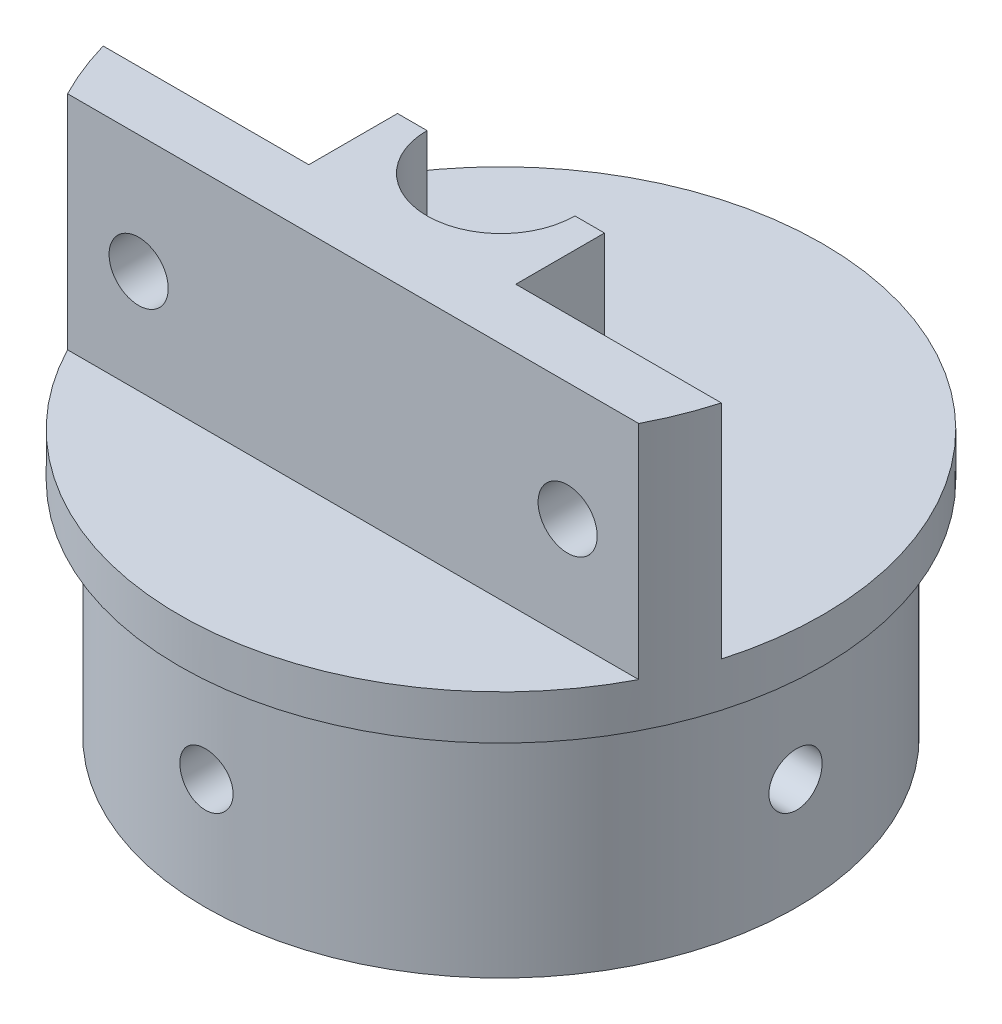
from build123d import *

# Parameters (mm, degrees)
SKETCH1_R                  = 25.4
SKETCH1_R_2                = 22.86
TUBE_CONNECTION_RING_DEPTH = 19.05
SKETCH6_R                  = 2.286
SCREW_HOLE_DEPTH           = 19.05
NUT_PRESS_FIT_HOLE_START   = -11.059647
NUT_PRESS_FIT_HOLE_DEPTH   = 3.81
CIRPATTERN1_COUNT          = 4
SCREW_HOLE_CHAMFER_SIZE    = 2.884664172
SCREW_HOLE_CHAMFER_SIZE_2  = 2.54
SKETCH12_R                 = 27.6225
SKETCH12_R_2               = 3.302
TOP_PLATE_DEPTH            = 3.81
HINGE_HOLE_DEPTH           = 19.05
HINGE_HOLE_CUT_REACH       = 66.384
SKETCH14_R                 = 2.54


with BuildPart() as part:
    # Sketch1 → tube_connection_ring (new body)
    # profile 1 of 5: a face of its own
    with BuildSketch(Plane(origin=(0, 0, 0), x_dir=(1, 0, 0), z_dir=(0, 1, 0))):
        with Locations(Location((0, 0, 0), (0, 0, 90))):
            Circle(SKETCH1_R)
        Circle(SKETCH1_R_2, mode=Mode.SUBTRACT)
    # profile 2 of 5: a face of its own
    with BuildSketch(Plane(origin=(0, 0, 0), x_dir=(1, 0, 0), z_dir=(0, 1, 0))):
        with BuildLine():
            ThreePointArc((22.86, 0), (22.633970791, 3.206706444), (21.960352912, 6.35))
            Line((21.960352912, 6.35), (14.340352912, 3.175))
            Line((14.340352912, 3.175), (14.340352912, -3.175))
            Line((14.340352912, -3.175), (21.960352912, -6.35))
            ThreePointArc((21.960352912, -6.35), (22.633970791, -3.206706444), (22.86, 0))
        make_face()
    # profile 3 of 5: a face of its own
    with BuildSketch(Plane(origin=(0, 0, 0), x_dir=(1, 0, 0), z_dir=(0, 1, 0))):
        with BuildLine():
            ThreePointArc((-6.35, -21.960352912), (0, -22.86), (6.35, -21.960352912))
            Line((6.35, -21.960352912), (3.175, -14.340352912))
            Line((3.175, -14.340352912), (-3.175, -14.340352912))
            Line((-3.175, -14.340352912), (-6.35, -21.960352912))
        make_face()
    # profile 4 of 5: a face of its own
    with BuildSketch(Plane(origin=(0, 0, 0), x_dir=(1, 0, 0), z_dir=(0, 1, 0))):
        with BuildLine():
            Line((-14.340352912, 3.175), (-21.960352912, 6.35))
            ThreePointArc((-21.960352912, 6.35), (-22.86, 0), (-21.960352912, -6.35))
            Line((-21.960352912, -6.35), (-14.340352912, -3.175))
            Line((-14.340352912, -3.175), (-14.340352912, 3.175))
        make_face()
    # profile 5 of 5: a face of its own
    with BuildSketch(Plane(origin=(0, 0, 0), x_dir=(1, 0, 0), z_dir=(0, 1, 0))):
        with BuildLine():
            Line((3.175, 14.340352912), (6.35, 21.960352912))
            ThreePointArc((6.35, 21.960352912), (0, 22.86), (-6.35, 21.960352912))
            Line((-6.35, 21.960352912), (-3.175, 14.340352912))
            Line((-3.175, 14.340352912), (3.175, 14.340352912))
        make_face()
    extrude(amount=TUBE_CONNECTION_RING_DEPTH)

    # Sketch6 → screw_hole (cut)
    with BuildSketch(Plane(origin=(25.4, 0, 0), x_dir=(0, 0, -1), z_dir=(1, 0, 0))):
        with Locations((0, 9.525)):
            Circle(SKETCH6_R)
    screw_hole = extrude(amount=-SCREW_HOLE_DEPTH, mode=Mode.SUBTRACT)

    # Sketch11 → nut_press_fit_hole (cut)
    with BuildSketch(Plane(origin=(25.4, 0, 0), x_dir=(0, 0, -1), z_dir=(1, 0, 0)).offset(NUT_PRESS_FIT_HOLE_START)):
        Polygon((0, 4.09906217), (4.699, 6.812031085), (4.699, 12.237968915), (0, 14.95093783), (-4.699, 12.237968915), (-4.699, 6.812031085), align=None)
    nut_press_fit_hole = extrude(amount=NUT_PRESS_FIT_HOLE_DEPTH, mode=Mode.SUBTRACT)

    # CirPattern1: screw_hole, nut_press_fit_hole ×4 about axis
    cirpattern1_axis = Axis((0, 0, 0), (0, 1, 0))
    add([screw_hole.rotate(cirpattern1_axis, i * 360 / CIRPATTERN1_COUNT) for i in range(1, CIRPATTERN1_COUNT)], mode=Mode.SUBTRACT)
    add([nut_press_fit_hole.rotate(cirpattern1_axis, i * 360 / CIRPATTERN1_COUNT) for i in range(1, CIRPATTERN1_COUNT)], mode=Mode.SUBTRACT)

    # screw_hole_chamfer
    # the kernel refuses this chamfer: 2.884664172, 2.54 mm, written as the material it adds along each edge
    with BuildSketch(Plane(origin=(-6.35, 0, -21.960352912), x_dir=(-0.9446263547307573, 0, 0.32814790864499105), z_dir=(0, 1, 0)), Plane(origin=(-21.960352912, 0, 6.35), x_dir=(0.3281479086449895, 0, 0.944626354730758), z_dir=(0, 1, 0)), Plane(origin=(6.35, 0, 21.960352912), x_dir=(0.9446263547307586, 0, -0.32814790864498755), z_dir=(0, 1, 0)), Plane(origin=(21.960352912, 0, -6.35), x_dir=(-0.3281479086449886, 0, -0.9446263547307582), z_dir=(0, 1, 0))) as screw_hole_chamfer_piece_1:
        with BuildLine():
            Line((2.415733057, 0), (-SCREW_HOLE_CHAMFER_SIZE * 0.0604120669079, SCREW_HOLE_CHAMFER_SIZE * 0.998173522936))
            Line((-SCREW_HOLE_CHAMFER_SIZE * 0.0604120669079, SCREW_HOLE_CHAMFER_SIZE * 0.998173522936), (0, 0))
            ThreePointArc((0, 0), (1.246430784, -0.031900132), (2.415733057, 0))
        make_face()
    extrude(amount=19.05)
    with BuildSketch(Plane(origin=(-21.960352912, 0, -6.35), x_dir=(0.9230769230769231, 0, 0.38461538461538464), z_dir=(0, 1, 0)), Plane(origin=(-6.35, 0, 21.960352912), x_dir=(0.3846153846153849, 0, -0.9230769230769229), z_dir=(0, 1, 0)), Plane(origin=(21.960352912, 0, 6.35), x_dir=(-0.9230769230769229, 0, -0.3846153846153849), z_dir=(0, 1, 0))) as screw_hole_chamfer_piece_2:
        with BuildLine():
            Line((SCREW_HOLE_CHAMFER_SIZE_2, 0), (-0.146371443, 2.686371443))
            ThreePointArc((-0.146371443, 2.686371443), (-0.11503611, 1.383925534), (0, 0))
            Line((0, 0), (SCREW_HOLE_CHAMFER_SIZE_2, 0))
        make_face()
    extrude(amount=19.05)
    with BuildSketch(Plane(origin=(6.35, 0, -21.960352912), x_dir=(0.9426351264301257, 0, 0.3338248319404367), z_dir=(0, 1, 0))) as screw_hole_chamfer_piece_3:
        with BuildLine():
            Line((2.690356134, 0), (-SCREW_HOLE_CHAMFER_SIZE_2 * 0.0544059729896, -SCREW_HOLE_CHAMFER_SIZE_2 * 0.99851889822))
            Line((-SCREW_HOLE_CHAMFER_SIZE_2 * 0.0544059729896, -SCREW_HOLE_CHAMFER_SIZE_2 * 0.99851889822), (0, 0))
            ThreePointArc((0, 0), (1.388134451, 0.039571914), (2.690356134, 0))
        make_face()
    extrude(amount=19.05)

    # Sketch12 → top_plate (add)
    with BuildSketch(Plane(origin=(0, 19.05, 0), x_dir=(1, 0, 0), z_dir=(0, 1, 0))):
        with Locations(Location((0, 0, 0), (0, 0, 90))):
            Circle(SKETCH12_R)
        with Locations(Location((0, 0, 0), (0, 0, 90))):
            Circle(SKETCH12_R_2, mode=Mode.SUBTRACT)
    extrude(amount=TOP_PLATE_DEPTH)

    # Sketch13 → hinge_hole (add)
    with BuildSketch(Plane(origin=(0, 22.86, 0), x_dir=(1, 0, 0), z_dir=(0, 1, 0))):
        with BuildLine():
            ThreePointArc((24.529828908, -12.7), (25.666241564, -10.210119991), (26.550670542, -7.62))
            Line((26.550670542, -7.62), (8.89, -7.62))
            Line((8.89, -7.62), (8.89, 0))
            Line((8.89, 0), (6.35, 0))
            ThreePointArc((6.35, 0), (0, -6.35), (-6.35, 0))
            Line((-6.35, 0), (-8.89, 0))
            Line((-8.89, 0), (-8.89, -7.62))
            Line((-8.89, -7.62), (-26.550670542, -7.62))
            ThreePointArc((-26.550670542, -7.62), (-25.666241564, -10.210119991), (-24.529828908, -12.7))
            Line((-24.529828908, -12.7), (24.529828908, -12.7))
        make_face()
    extrude(amount=HINGE_HOLE_DEPTH)

    # Sketch14 → hinge_hole_cut (cut, up to next)
    with BuildSketch(Plane.XY.offset(12.7), mode=Mode.PRIVATE) as hinge_hole_cut_sk1:
        with Locations((18.424251671, 31.75)):
            Circle(SKETCH14_R)
    hinge_hole_cut_tool1 = extrude(hinge_hole_cut_sk1.sketch, amount=-HINGE_HOLE_CUT_REACH, mode=Mode.PRIVATE) & part.part
    # Sketch14 → hinge_hole_cut (cut, up to next)
    with BuildSketch(Plane.XY.offset(12.7), mode=Mode.PRIVATE) as hinge_hole_cut_sk2:
        with Locations((-18.424251671, 31.75)):
            Circle(SKETCH14_R)
    hinge_hole_cut_tool2 = extrude(hinge_hole_cut_sk2.sketch, amount=-HINGE_HOLE_CUT_REACH, mode=Mode.PRIVATE) & part.part
    add(hinge_hole_cut_tool1.solids().sort_by_distance((18.424252, 31.75, 12.7))[0], mode=Mode.SUBTRACT)
    add(hinge_hole_cut_tool2.solids().sort_by_distance((-18.424252, 31.75, 12.7))[0], mode=Mode.SUBTRACT)


solid = part.part
